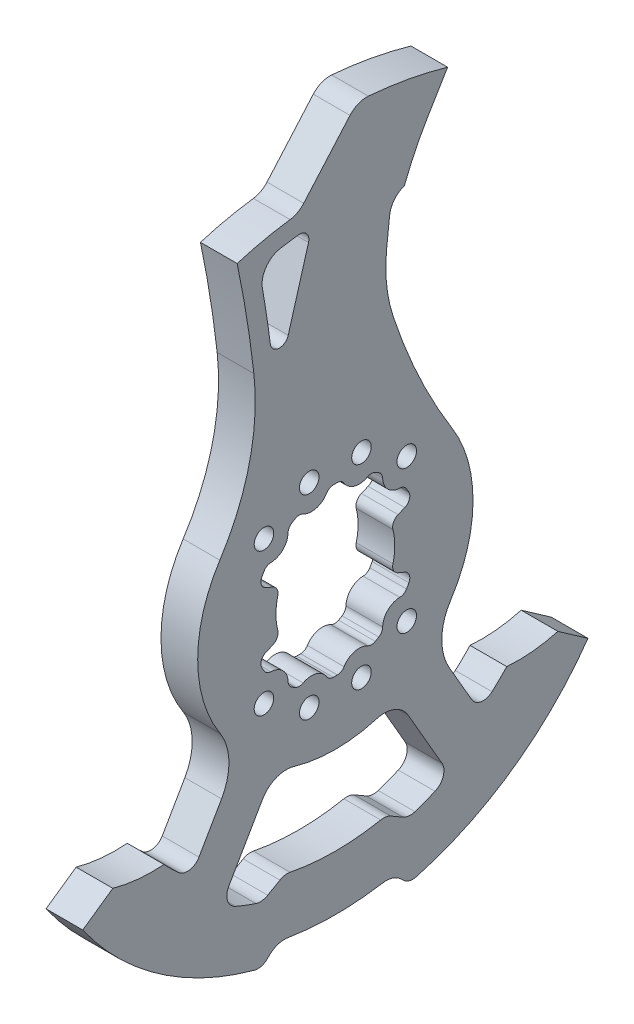
from build123d import *

# Parameters (mm, degrees)
BOSS_EXTRUDE1_DEPTH     = 6.35
CUT_EXTRUDE1_DEPTH      = 166.096382574
FILLET1_R               = 7.62
FILLET4_R               = 19.05
FILLET2_R               = 4.572
CUT_EXTRUDE2_DEPTH      = 165.894962691
FILLET3_R               = 5.08
FILLET5_R               = 9.525
CUT_EXTRUDE4_DEPTH      = 165.894962691
F_1_4_CLEARANCE_HOLE1_D = 6.7564
CIRPATTERN1_COUNT       = 12


with BuildPart() as part:
    # Sketch2 → Boss-Extrude1 (new, symmetric)
    with BuildSketch(Plane(origin=(0, 0, 0), x_dir=(0, 0, -1), z_dir=(1, 0, 0))):
        with BuildLine():
            Line((38.857972086, 134.186988957), (32.288511437, 123.318125779))
            ThreePointArc((32.288511437, 123.318125779), (27.710359244, 114.938607951), (23.879951403, 106.191964463))
            Line((23.879951403, 106.191964463), (19.233747032, 104.137898998))
            Line((19.233747032, 104.137898998), (17.741690169, 90.290745696))
            ThreePointArc((17.741690169, 90.290745696), (17.728604087, 79.52900815), (19.982810615, 69.005999114))
            ThreePointArc((19.982810615, 69.005999114), (28.906370723, 46.458546299), (40.452318764, 25.134648031))
            ThreePointArc((40.452318764, 25.134648031), (47.237687206, -6.06147939), (32.795747053, -34.533745818))
            Line((32.795747053, -34.533745818), (49.900086632, -64.159330998))
            ThreePointArc((49.900086632, -64.159330998), (54.760018309, -60.06478831), (59.285209805, -55.603078137))
            ThreePointArc((59.285209805, -55.603078137), (68.209440684, -55.534234835), (76.983909122, -53.904713488))
            Line((76.983909122, -53.904713488), (87.387140085, -61.18913423))
            ThreePointArc((87.387140085, -61.18913423), (60.250819498, -88.036703424), (25.4, -103.612076516))
            Line((25.4, -103.612076516), (20.08663208, -98.298708596))
            ThreePointArc((20.08663208, -98.298708596), (0, -100.33), (-20.08663208, -98.298708596))
            Line((-20.08663208, -98.298708596), (-25.4, -103.612076516))
            ThreePointArc((-25.4, -103.612076516), (-60.250819498, -88.036703424), (-87.387140085, -61.18913423))
            Line((-87.387140085, -61.18913423), (-76.983909122, -53.904713488))
            ThreePointArc((-76.983909122, -53.904713488), (-68.209440684, -55.534234835), (-59.285209805, -55.603078137))
            ThreePointArc((-59.285209805, -55.603078137), (-54.760018309, -60.06478831), (-49.900086632, -64.159330998))
            Line((-49.900086632, -64.159330998), (-32.795747053, -34.533745818))
            ThreePointArc((-32.795747053, -34.533745818), (-47.29370877, -5.607649758), (-39.962224525, 25.90677973))
            ThreePointArc((-39.962224525, 25.90677973), (-29.733104482, 49.880584834), (-28.182036035, 75.899278396))
            ThreePointArc((-28.182036035, 75.899278396), (-30.650883036, 93.914203021), (-33.97643981, 111.790818665))
            ThreePointArc((-33.97643981, 111.790818665), (-23.520692105, 114.448078371), (-12.864423742, 116.12963533))
            Line((-12.864423742, 116.12963533), (7.554913188, 139.495567265))
            ThreePointArc((7.554913188, 139.495567265), (23.357744557, 137.733459149), (38.857972086, 134.186988957))
        make_face()
    extrude(amount=BOSS_EXTRUDE1_DEPTH, both=True)

    # Sketch3 → Cut-Extrude1 (cut, through all)
    with BuildSketch(Plane(origin=(6.35, 0, 0), x_dir=(0, 0, -1), z_dir=(1, 0, 0))):
        with BuildLine():
            Line((-9.285141158, 105.720620362), (-16.311280791, 81.457477673))
            ThreePointArc((-16.311280791, 81.457477673), (-19.607878955, 79.17522742), (-22.510739472, 81.941023235))
            ThreePointArc((-22.510739472, 81.941023235), (-24.333905773, 94.627290323), (-26.575778708, 107.246296375))
            ThreePointArc((-26.575778708, 107.246296375), (-19.677886455, 108.723598564), (-12.699781708, 109.757713372))
            ThreePointArc((-12.699781708, 109.757713372), (-9.910690992, 108.654146335), (-9.285141158, 105.720620362))
        make_face()
    extrude(amount=-CUT_EXTRUDE1_DEPTH, mode=Mode.SUBTRACT)

    # Fillet1
    fillet1_edges = [part.edges().sort_by_distance(p)[0] for p in [
        (0, 104.137898998, -19.233747032),
        (0, 107.246296375, 26.575778708),
        (0, 139.495567265, -7.554913188),
        (0, 116.12963533, 12.864423742),
        (0, -98.298708596, -20.08663208),
        (0, -98.298708596, 20.08663208),
    ]]
    fillet(fillet1_edges, radius=FILLET1_R)

    # Fillet4
    fillet4_edges = [part.edges().sort_by_distance(p)[0] for p in [
        (0, -34.533745818, -32.795747053),
        (0, -34.533745818, 32.795747053),
    ]]
    fillet(fillet4_edges, radius=FILLET4_R)

    # Fillet2
    fillet2_edges = [part.edges().sort_by_distance(p)[0] for p in [
        (0, -103.612076516, 25.4),
        (0, -103.612076516, -25.4),
        (0, -64.159330998, -49.900086632),
        (0, -64.159330998, 49.900086632),
    ]]
    fillet(fillet2_edges, radius=FILLET2_R)

    # Sketch4 → Cut-Extrude2 (cut, through all)
    with BuildSketch(Plane(origin=(6.35, 0, 0), x_dir=(0, 0, -1), z_dir=(1, 0, 0))):
        with BuildLine():
            Line((-21.184299428, -46.172128582), (-39.645963646, -78.148669001))
            ThreePointArc((-39.645963646, -78.148669001), (-32.613253082, -81.335063923), (-25.327366164, -83.890055568))
            Line((-25.327366164, -83.890055568), (-17.5035126, -79.372951606))
            ThreePointArc((-17.5035126, -79.372951606), (-8.803547394, -80.801831373), (0, -81.28))
            Line((0, -81.28), (0, -50.8))
            ThreePointArc((0, -50.8), (-10.841952501, -49.629548315), (-21.184299428, -46.172128582))
        make_face()
    cut_extrude2 = extrude(amount=-CUT_EXTRUDE2_DEPTH, mode=Mode.SUBTRACT)

    # Mirror1: Cut-Extrude2 across plane
    add(cut_extrude2.mirror(Plane(origin=(-6.35, -81.28, 0), x_dir=(1, 0, 0), z_dir=(0, 0, -1))), mode=Mode.SUBTRACT)

    # Fillet3
    fillet3_edges = [part.edges().sort_by_distance(p)[0] for p in [
        (0, -78.148669001, -39.645963646),
        (0, -83.890055568, -25.327366164),
        (0, -79.372951606, -17.5035126),
        (0, -79.372951606, 17.5035126),
        (0, -83.890055568, 25.327366164),
        (0, -78.148669001, 39.645963646),
    ]]
    fillet(fillet3_edges, radius=FILLET3_R)

    # Fillet5
    fillet5_edges = [part.edges().sort_by_distance(p)[0] for p in [
        (0, -46.172128582, -21.184299428),
        (0, -46.172128582, 21.184299428),
    ]]
    fillet(fillet5_edges, radius=FILLET5_R)

    # Sketch5 → Cut-Extrude4 (cut, through all)
    with BuildSketch(Plane.ZY.offset(6.35)):
        with BuildLine():
            Line((21.70681456, 8.716329368), (24.035660602, 9.680968983))
            ThreePointArc((24.035660602, 9.680968983), (25.596901419, 11.320415271), (25.431134545, 13.578241298))
            ThreePointArc((25.431134545, 13.578241298), (25.029758681, 14.304629369), (24.607640645, 15.019163188))
            ThreePointArc((24.607640645, 15.019163188), (23.62126299, 15.982367595), (22.294378957, 16.356643388))
            ThreePointArc((22.294378957, 16.356643388), (18.140117365, 18.140117365), (16.356643388, 22.294378957))
            ThreePointArc((16.356643388, 22.294378957), (15.982367595, 23.62126299), (15.019163188, 24.607640645))
            ThreePointArc((15.019163188, 24.607640645), (14.4145, 24.966646366), (13.801260332, 25.310797187))
            ThreePointArc((13.801260332, 25.310797187), (12.465430022, 25.651767845), (11.129176844, 25.312458173))
            ThreePointArc((11.129176844, 25.312458173), (6.639743783, 24.779861148), (3.018079217, 27.485820232))
            ThreePointArc((3.018079217, 27.485820232), (2.030504855, 28.447797617), (0.703156542, 28.82042352))
            ThreePointArc((0.703156542, 28.82042352), (0, 28.829), (-0.703156542, 28.82042352))
            ThreePointArc((-0.703156542, 28.82042352), (-2.030504855, 28.447797617), (-3.018079217, 27.485820232))
            ThreePointArc((-3.018079217, 27.485820232), (-6.639743783, 24.779861148), (-11.129176844, 25.312458173))
            ThreePointArc((-11.129176844, 25.312458173), (-12.465430022, 25.651767845), (-13.801260332, 25.310797187))
            ThreePointArc((-13.801260332, 25.310797187), (-14.4145, 24.966646366), (-15.019163188, 24.607640645))
            ThreePointArc((-15.019163188, 24.607640645), (-15.982367595, 23.62126299), (-16.356643388, 22.294378957))
            ThreePointArc((-16.356643388, 22.294378957), (-18.140117365, 18.140117365), (-22.294378957, 16.356643388))
            ThreePointArc((-22.294378957, 16.356643388), (-23.62126299, 15.982367595), (-24.607640645, 15.019163188))
            ThreePointArc((-24.607640645, 15.019163188), (-25.029758681, 14.304629369), (-25.431134545, 13.578241298))
            ThreePointArc((-25.431134545, 13.578241298), (-25.596901419, 11.320415271), (-24.035660602, 9.680968983))
            Line((-24.035660602, 9.680968983), (-21.70681456, 8.716329368))
            ThreePointArc((-21.70681456, 8.716329368), (-20.145894023, 7.261198143), (-19.921848673, 5.139009772))
            ThreePointArc((-19.921848673, 5.139009772), (-20.574, 0), (-19.921848673, -5.139009772))
            ThreePointArc((-19.921848673, -5.139009772), (-20.145894023, -7.261198143), (-21.70681456, -8.716329368))
            Line((-21.70681456, -8.716329368), (-24.035660602, -9.680968983))
            ThreePointArc((-24.035660602, -9.680968983), (-25.596901419, -11.320415271), (-25.431134545, -13.578241298))
            ThreePointArc((-25.431134545, -13.578241298), (-25.029758681, -14.304629369), (-24.607640645, -15.019163188))
            ThreePointArc((-24.607640645, -15.019163188), (-23.62126299, -15.982367595), (-22.294378957, -16.356643388))
            ThreePointArc((-22.294378957, -16.356643388), (-18.140117365, -18.140117365), (-16.356643388, -22.294378957))
            ThreePointArc((-16.356643388, -22.294378957), (-15.982367595, -23.62126299), (-15.019163188, -24.607640645))
            ThreePointArc((-15.019163188, -24.607640645), (-14.4145, -24.966646366), (-13.801260332, -25.310797187))
            ThreePointArc((-13.801260332, -25.310797187), (-12.465430022, -25.651767845), (-11.129176844, -25.312458173))
            ThreePointArc((-11.129176844, -25.312458173), (-6.639743783, -24.779861148), (-3.018079217, -27.485820232))
            ThreePointArc((-3.018079217, -27.485820232), (-2.030504855, -28.447797617), (-0.703156542, -28.82042352))
            ThreePointArc((-0.703156542, -28.82042352), (0, -28.829), (0.703156542, -28.82042352))
            ThreePointArc((0.703156542, -28.82042352), (2.030504855, -28.447797617), (3.018079217, -27.485820232))
            ThreePointArc((3.018079217, -27.485820232), (6.639743783, -24.779861148), (11.129176844, -25.312458173))
            ThreePointArc((11.129176844, -25.312458173), (12.465430022, -25.651767845), (13.801260332, -25.310797187))
            ThreePointArc((13.801260332, -25.310797187), (14.4145, -24.966646366), (15.019163188, -24.607640645))
            ThreePointArc((15.019163188, -24.607640645), (15.982367595, -23.62126299), (16.356643388, -22.294378957))
            ThreePointArc((16.356643388, -22.294378957), (18.140117365, -18.140117365), (22.294378957, -16.356643388))
            ThreePointArc((22.294378957, -16.356643388), (23.62126299, -15.982367595), (24.607640645, -15.019163188))
            ThreePointArc((24.607640645, -15.019163188), (25.029758681, -14.304629369), (25.431134545, -13.578241298))
            ThreePointArc((25.431134545, -13.578241298), (25.596901419, -11.320415271), (24.035660602, -9.680968983))
            Line((24.035660602, -9.680968983), (21.70681456, -8.716329368))
            ThreePointArc((21.70681456, -8.716329368), (20.145894023, -7.261198143), (19.921848673, -5.139009772))
            ThreePointArc((19.921848673, -5.139009772), (20.574, 0), (19.921848673, 5.139009772))
            ThreePointArc((19.921848673, 5.139009772), (20.145894023, 7.261198143), (21.70681456, 8.716329368))
        make_face()
    extrude(amount=-CUT_EXTRUDE4_DEPTH, mode=Mode.SUBTRACT)

    # 1/4 Clearance Hole1 (through all)
    with Locations(Plane(origin=(6.35, 0, 0), x_dir=(0, 0, -1), z_dir=(1, 0, 0))):
        with Locations((9.03925515, 33.734959483)):
            f_1_4_clearance_hole1 = Hole(F_1_4_CLEARANCE_HOLE1_D / 2)

    # CirPattern1: 1/4 Clearance Hole1 ×12 about axis, 4 skipped
    cirpattern1_axis = Axis((-6.985, 0, 0), (1, 0, 0))
    add([f_1_4_clearance_hole1.rotate(cirpattern1_axis, i * 360 / CIRPATTERN1_COUNT) for i in range(1, CIRPATTERN1_COUNT) if i not in (3, 4, 9, 10)], mode=Mode.SUBTRACT)


solid = part.part
